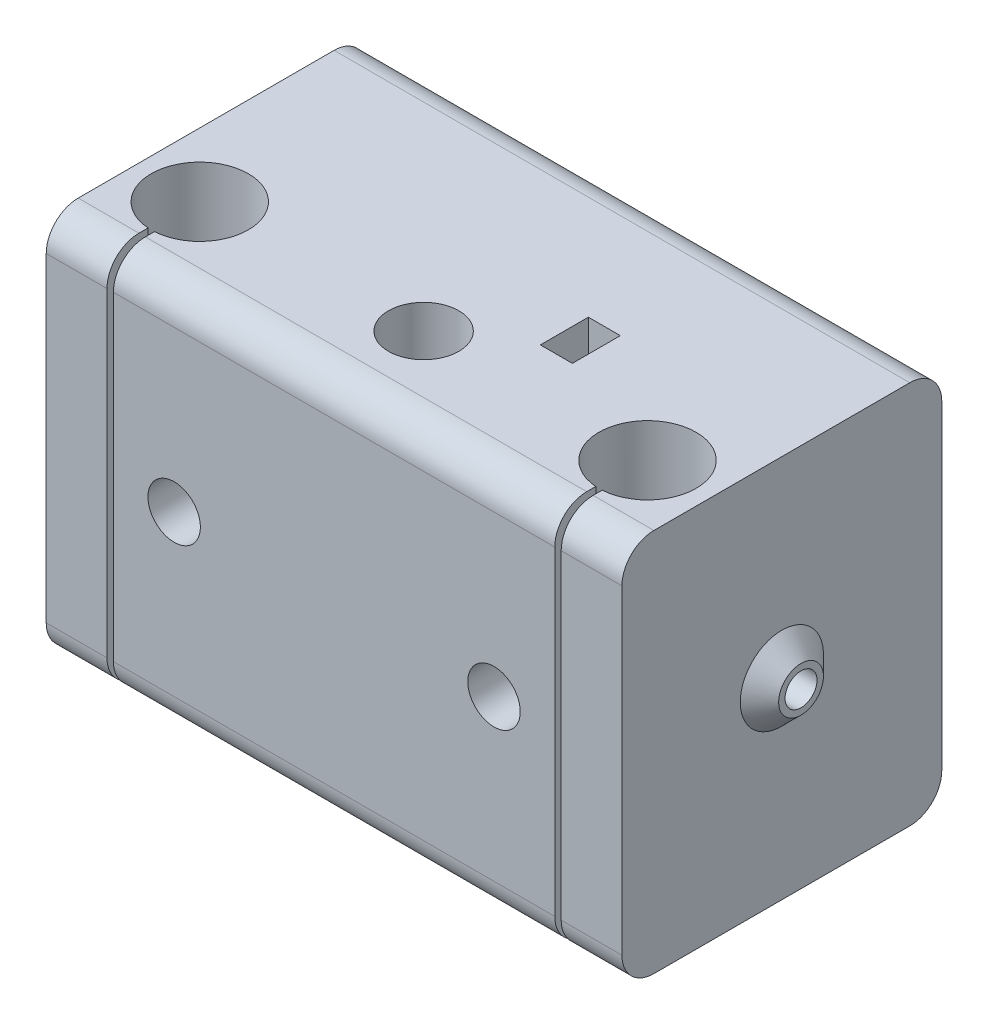
from build123d import *

# Parameters (mm, degrees)
BOSS_EXTRUDE1_DEPTH     = 90
SKETCH2_R               = 7.6
SKETCH2_R_2             = 5.5
CUT_EXTRUDE1_DEPTH      = 90
SKETCH3_R               = 4.1
CUT_EXTRUDE2_DEPTH      = 90
SKETCH10_W              = 1
SKETCH10_H              = 31.35052841
CUT_EXTRUDE_THIN1_DEPTH = 70
SKETCH11_R              = 11.5
CUT_EXTRUDE6_DEPTH      = 7
SKETCH12_R              = 1.95
CUT_EXTRUDE7_DEPTH      = 15
BOSS_EXTRUDE2_START     = -3
SKETCH16_R              = 4.1
BOSS_EXTRUDE2_DEPTH     = 3
FILLET1_R               = 2
SKETCH17_R              = 2.5
CUT_EXTRUDE8_DEPTH      = 30
SKETCH18_W              = 5
SKETCH18_H              = 7.5
CUT_EXTRUDE9_DEPTH      = 44
BOSS_EXTRUDE3_START     = 3
SKETCH19_R              = 3.5
SKETCH19_R_2            = 2.5
BOSS_EXTRUDE3_DEPTH     = 3
CHAMFER1_SIZE           = 3


with BuildPart() as part:
    # Sketch1 → Boss-Extrude1 (new body)
    with BuildSketch(Plane(origin=(0, 0, 0), x_dir=(0, 0, -1), z_dir=(1, 0, 0))):
        with BuildLine():
            Line((-20, -30), (20, -30))
            ThreePointArc((20, -30), (23.535533906, -28.535533906), (25, -25))
            Line((25, -25), (25, 25))
            ThreePointArc((25, 25), (23.535533906, 28.535533906), (20, 30))
            Line((20, 30), (-20, 30))
            ThreePointArc((-20, 30), (-23.535533906, 28.535533906), (-25, 25))
            Line((-25, 25), (-25, -25))
            ThreePointArc((-25, -25), (-23.535533906, -28.535533906), (-20, -30))
        make_face()
    extrude(amount=BOSS_EXTRUDE1_DEPTH)

    # Sketch2 → Cut-Extrude1 (cut)
    with BuildSketch(Plane(origin=(0, 30, 0), x_dir=(1, 0, 0), z_dir=(0, 1, 0))):
        with Locations(Location((10, -11, 0), (0, 0, 270))):
            Circle(SKETCH2_R)
        with Locations(Location((80, -11, 0), (0, 0, 270))):
            Circle(SKETCH2_R)
        with Locations(Location((45, -11, 0), (0, 0, 270))):
            Circle(SKETCH2_R_2)
    extrude(amount=-CUT_EXTRUDE1_DEPTH, mode=Mode.SUBTRACT)

    # Sketch3 → Cut-Extrude2 (cut)
    with BuildSketch(Plane.XY.offset(25)):
        with Locations((20, 0)):
            Circle(SKETCH3_R)
        with Locations((70, 0)):
            Circle(SKETCH3_R)
    extrude(amount=-CUT_EXTRUDE2_DEPTH, mode=Mode.SUBTRACT)

    # Sketch10 → Cut-Extrude-Thin1 (cut)
    with BuildSketch(Plane(origin=(0, 30, 0), x_dir=(1, 0, 0), z_dir=(0, 1, 0))):
        with Locations((10, -26.675264205)):
            Rectangle(SKETCH10_W, SKETCH10_H)
        with Locations((80, -26.675264205)):
            Rectangle(SKETCH10_W, SKETCH10_H)
    extrude(amount=-CUT_EXTRUDE_THIN1_DEPTH, mode=Mode.SUBTRACT)

    # Sketch11 → Cut-Extrude6 (cut)
    with BuildSketch(Plane(origin=(0, -30, 0), x_dir=(-1, 0, 0), z_dir=(0, -1, 0))):
        with Locations(Location((-45, -11, 0), (0, 0, 90))):
            Circle(SKETCH11_R)
    extrude(amount=-CUT_EXTRUDE6_DEPTH, mode=Mode.SUBTRACT)

    # Sketch12 → Cut-Extrude7 (cut)
    with BuildSketch(Plane(origin=(0, -23, 0), x_dir=(-1, 0, 0), z_dir=(0, -1, 0))):
        with Locations(Location((-45, -19, 0), (0, 0, 90))):
            Circle(SKETCH12_R)
        with Locations(Location((-53, -11, 0), (0, 0, 90))):
            Circle(SKETCH12_R)
        with Locations(Location((-45, -3, 0), (0, 0, 90))):
            Circle(SKETCH12_R)
        with Locations(Location((-37, -11, 0), (0, 0, 90))):
            Circle(SKETCH12_R)
    extrude(amount=-CUT_EXTRUDE7_DEPTH, mode=Mode.SUBTRACT)

    # Sketch16 → Boss-Extrude2 (add)
    with BuildSketch(Plane(origin=(0, 0, -25), x_dir=(-1, 0, 0), z_dir=(0, 0, -1)).offset(BOSS_EXTRUDE2_START)):
        with Locations(Location((-70, 0, 0), (0, 0, 180))):
            Circle(SKETCH16_R)
        with Locations(Location((-20, 0, 0), (0, 0, 180))):
            Circle(SKETCH16_R)
    extrude(amount=BOSS_EXTRUDE2_DEPTH)

    # Fillet1
    fillet1_edges = [part.edges().sort_by_distance(p)[0] for p in [
        (65.9, 0, -22),
        (15.9, 0, -22),
    ]]
    fillet(fillet1_edges, radius=FILLET1_R)

    # Sketch17 → Cut-Extrude8 (cut)
    with BuildSketch(Plane(origin=(90, 0, 0), x_dir=(0, 0, -1), z_dir=(1, 0, 0))):
        Circle(SKETCH17_R)
    extrude(amount=-CUT_EXTRUDE8_DEPTH, mode=Mode.SUBTRACT)

    # Sketch18 → Cut-Extrude9 (cut)
    with BuildSketch(Plane(origin=(0, 30, 0), x_dir=(1, 0, 0), z_dir=(0, 1, 0))):
        with Locations((58.5, 0)):
            Rectangle(SKETCH18_W, SKETCH18_H)
    extrude(amount=-CUT_EXTRUDE9_DEPTH, mode=Mode.SUBTRACT)

    # Sketch19 → Boss-Extrude3 (add)
    with BuildSketch(Plane(origin=(90, 0, 0), x_dir=(0, 0, -1), z_dir=(1, 0, 0)).offset(BOSS_EXTRUDE3_START)):
        with Locations(Location((0, 0, 0), (0, 0, 180))):
            Circle(SKETCH19_R)
        Circle(SKETCH19_R_2, mode=Mode.SUBTRACT)
    extrude(amount=-BOSS_EXTRUDE3_DEPTH)

    # Chamfer1
    chamfer1_edges = [part.edges().sort_by_distance(p)[0] for p in [
        (90, 0, -3.5),
    ]]
    chamfer(chamfer1_edges, length=CHAMFER1_SIZE - 0.0001)  # a hair under: the kernel refuses the full size


solid = part.part
